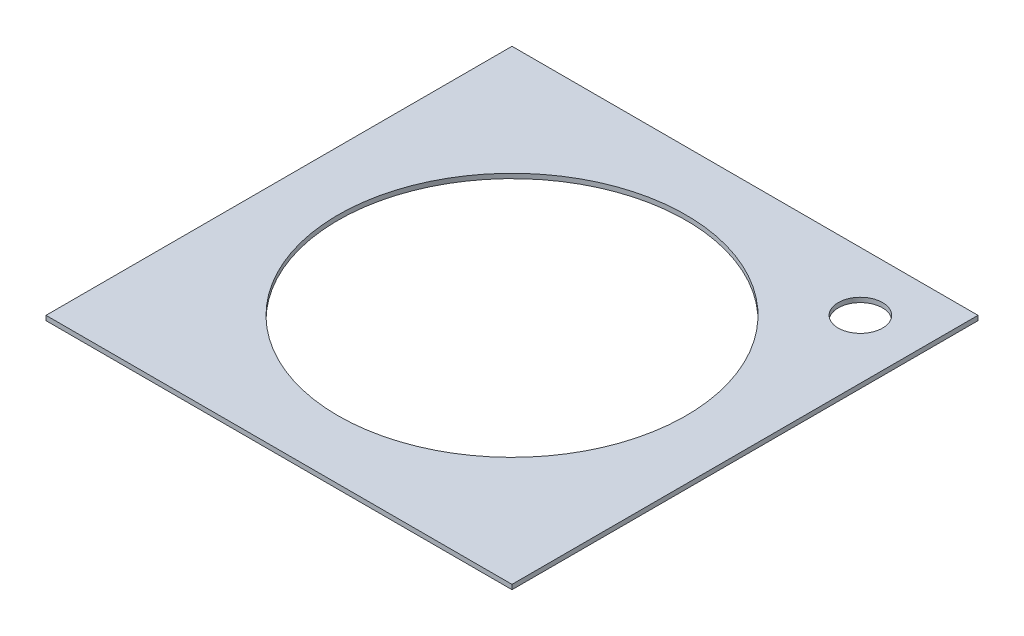
from build123d import *

# Parameters (mm, degrees)
SKETCH1_W           = 300
SKETCH1_H           = 300
BOSS_EXTRUDE1_DEPTH = 3
CUT_EXTRUDE1_REACH  = 426.275
SKETCH2_R           = 112
SKETCH2_R_2         = 14.255


with BuildPart() as part:
    # Sketch1 → Boss-Extrude1 (new body)
    with BuildSketch(Plane(origin=(0, 0, 0), x_dir=(1, 0, 0), z_dir=(0, 1, 0))):
        with Locations((150, -150)):
            Rectangle(SKETCH1_W, SKETCH1_H)
    extrude(amount=BOSS_EXTRUDE1_DEPTH)

    # Sketch2 → Cut-Extrude1 (cut, up to next)
    with BuildSketch(Plane(origin=(0, 3, 0), x_dir=(1, 0, 0), z_dir=(0, 1, 0)), mode=Mode.PRIVATE) as cut_extrude1_sk1:
        with Locations((150, -150)):
            Circle(SKETCH2_R)
    cut_extrude1_tool1 = extrude(cut_extrude1_sk1.sketch, amount=-CUT_EXTRUDE1_REACH, mode=Mode.PRIVATE) & part.part
    # Sketch2 → Cut-Extrude1 (cut, up to next)
    with BuildSketch(Plane(origin=(0, 3, 0), x_dir=(1, 0, 0), z_dir=(0, 1, 0)), mode=Mode.PRIVATE) as cut_extrude1_sk2:
        with Locations((262.147135496, -37.852864504)):
            Circle(SKETCH2_R_2)
    cut_extrude1_tool2 = extrude(cut_extrude1_sk2.sketch, amount=-CUT_EXTRUDE1_REACH, mode=Mode.PRIVATE) & part.part
    add(cut_extrude1_tool1.solids().sort_by_distance((150, 3, 150))[0], mode=Mode.SUBTRACT)
    add(cut_extrude1_tool2.solids().sort_by_distance((262.147135, 3, 37.852865))[0], mode=Mode.SUBTRACT)


solid = part.part
